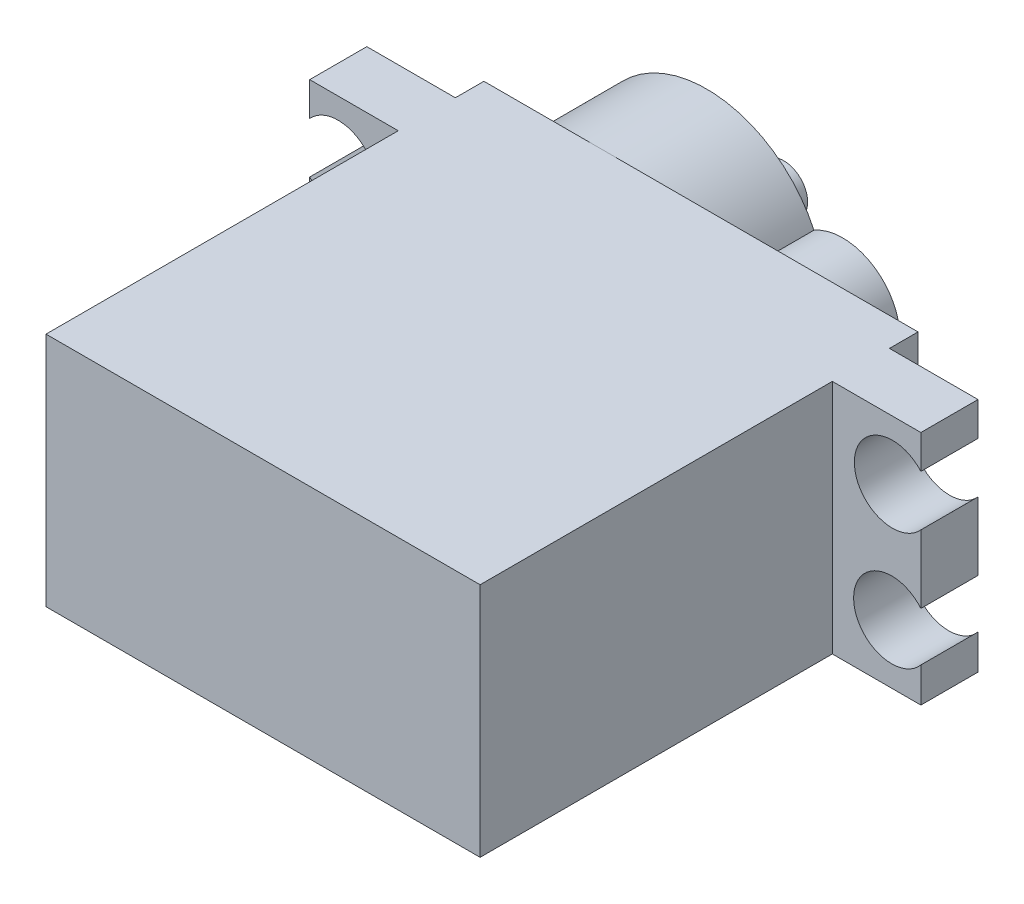
from build123d import *

# Parameters (mm, degrees)
SKETCH1_W             = 22.8
SKETCH1_H             = 12.4
BOSS_EXTRUDE1_DEPTH   = 18.5
SKETCH1_4_W           = 4.65
SKETCH1_4_H           = 12.4
BOSS_EXTRUDE2_DEPTH   = 2.5
BOSS_EXTRUDE2_2_DEPTH = 2.5
SKETCH1_11_W          = 4.65
SKETCH1_11_H          = 12.4
BOSS_EXTRUDE8_DEPTH   = 3
SKETCH1_13_W          = 22.8
SKETCH1_13_H          = 12.4
BOSS_EXTRUDE9_DEPTH   = 4.5
BOSS_EXTRUDE11_DEPTH  = 5.5
SKETCH10_R            = 1.25
BOSS_EXTRUDE12_DEPTH  = 4
BOSS_EXTRUDE13_DEPTH  = 5
CUT_EXTRUDE1_REACH    = 42.576
SKETCH15_R            = 2


with BuildPart() as part:
    # Sketch1 → Boss-Extrude1 (new body)
    with BuildSketch(Plane.XY):
        with Locations((16.05, 6.2)):
            Rectangle(SKETCH1_W, SKETCH1_H)
    extrude(amount=BOSS_EXTRUDE1_DEPTH)



with BuildPart() as body_2:
    # Sketch1<4> → Boss-Extrude2 (new body)
    with BuildSketch(Plane.XY):
        with Locations((2.325, 6.2)):
            Rectangle(SKETCH1_4_W, SKETCH1_4_H)
    extrude(amount=-BOSS_EXTRUDE2_DEPTH)



with BuildPart() as body_3:
    # Sketch1<4> → Boss-Extrude2 2 (new body)
    with BuildSketch(Plane.XY):
        with Locations((29.775, 6.2)):
            Rectangle(SKETCH1_4_W, SKETCH1_4_H)
    extrude(amount=-BOSS_EXTRUDE2_2_DEPTH)


with BuildPart() as body_2_1:
    add(body_2.part)

    add(body_3.part)  # Boss-Extrude8 merges body 3
    # Sketch1<11> → Boss-Extrude8 (add)
    with BuildSketch(Plane.XY):
        with Locations((2.325, 6.2)):
            Rectangle(SKETCH1_11_W, SKETCH1_11_H)
        with Locations((29.775, 6.2)):
            Rectangle(SKETCH1_11_W, SKETCH1_11_H)
    extrude(amount=-BOSS_EXTRUDE8_DEPTH)


with BuildPart() as part_1:
    add(part.part)

    add(body_2_1.part)  # Boss-Extrude9 merges body 2
    # Sketch1<13> → Boss-Extrude9 (add)
    with BuildSketch(Plane.XY):
        with Locations((16.05, 6.2)):
            Rectangle(SKETCH1_13_W, SKETCH1_13_H)
    extrude(amount=-BOSS_EXTRUDE9_DEPTH)

    # Sketch8 → Boss-Extrude11 (add)
    with BuildSketch(Plane(origin=(0, 0, -4.5), x_dir=(-1, 0, 0), z_dir=(0, 0, -1))):
        with BuildLine():
            ThreePointArc((-16.482252321, 3.608140862), (-4.65, 6.2), (-16.482252321, 8.791859138))
            ThreePointArc((-16.482252321, 8.791859138), (-20.992969439, 6.2), (-16.482252321, 3.608140862))
        make_face()
    extrude(amount=BOSS_EXTRUDE11_DEPTH)

    # Sketch10 → Boss-Extrude12 (add)
    with BuildSketch(Plane(origin=(0, 0, -10), x_dir=(-1, 0, 0), z_dir=(0, 0, -1))):
        with Locations((-10.902835345, 5.910258943)):
            Circle(SKETCH10_R)
    extrude(amount=BOSS_EXTRUDE12_DEPTH)

    # Sketch8<2> → Boss-Extrude13 (add)
    with BuildSketch(Plane(origin=(0, 0, -4.5), x_dir=(-1, 0, 0), z_dir=(0, 0, -1))):
        with BuildLine():
            ThreePointArc((-16.482252321, 3.608140862), (-4.65, 6.2), (-16.482252321, 8.791859138))
            ThreePointArc((-16.482252321, 8.791859138), (-20.992969439, 6.2), (-16.482252321, 3.608140862))
        make_face()
    extrude(amount=BOSS_EXTRUDE13_DEPTH)

    # Sketch15 → Cut-Extrude1 (cut, up to next)
    with BuildSketch(Plane(origin=(0, 0, -3), x_dir=(-1, 0, 0), z_dir=(0, 0, -1)), mode=Mode.PRIVATE) as cut_extrude1_sk1:
        with Locations((-30.567157508, 3.111527569)):
            Circle(SKETCH15_R)
    cut_extrude1_tool1 = extrude(cut_extrude1_sk1.sketch, amount=-CUT_EXTRUDE1_REACH, mode=Mode.PRIVATE) & part_1.part
    # Sketch15 → Cut-Extrude1 (cut, up to next)
    with BuildSketch(Plane(origin=(0, 0, -3), x_dir=(-1, 0, 0), z_dir=(0, 0, -1)), mode=Mode.PRIVATE) as cut_extrude1_sk2:
        with BuildLine():
            Line((-32.1, 10.629307241), (-32.1, 7.970692759))
            ThreePointArc((-32.1, 7.970692759), (-28.605696731, 9.3), (-32.1, 10.629307241))
        make_face()
    cut_extrude1_tool2 = extrude(cut_extrude1_sk2.sketch, amount=-CUT_EXTRUDE1_REACH, mode=Mode.PRIVATE) & part_1.part
    # Sketch15 → Cut-Extrude1 (cut, up to next)
    with BuildSketch(Plane(origin=(0, 0, -3), x_dir=(-1, 0, 0), z_dir=(0, 0, -1)), mode=Mode.PRIVATE) as cut_extrude1_sk3:
        with BuildLine():
            ThreePointArc((0, 4.429307241), (-3.494303269, 3.1), (0, 1.770692759))
            Line((0, 1.770692759), (0, 4.429307241))
        make_face()
    cut_extrude1_tool3 = extrude(cut_extrude1_sk3.sketch, amount=-CUT_EXTRUDE1_REACH, mode=Mode.PRIVATE) & part_1.part
    # Sketch15 → Cut-Extrude1 (cut, up to next)
    with BuildSketch(Plane(origin=(0, 0, -3), x_dir=(-1, 0, 0), z_dir=(0, 0, -1)), mode=Mode.PRIVATE) as cut_extrude1_sk4:
        with Locations((-1.494303269, 9.3)):
            Circle(SKETCH15_R)
    cut_extrude1_tool4 = extrude(cut_extrude1_sk4.sketch, amount=-CUT_EXTRUDE1_REACH, mode=Mode.PRIVATE) & part_1.part
    add(cut_extrude1_tool1.solids().sort_by_distance((30.567158, 3.111528, -3))[0], mode=Mode.SUBTRACT)
    add(cut_extrude1_tool2.solids().sort_by_distance((30.471216, 9.3, -3))[0], mode=Mode.SUBTRACT)
    add(cut_extrude1_tool3.solids().sort_by_distance((1.628784, 3.1, -3))[0], mode=Mode.SUBTRACT)
    add(cut_extrude1_tool4.solids().sort_by_distance((1.494303, 9.3, -3))[0], mode=Mode.SUBTRACT)


solid = part_1.part
